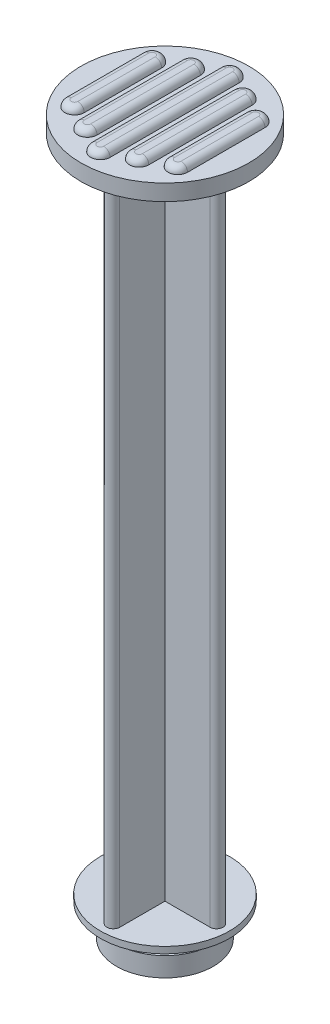
from build123d import *

# Parameters (mm, degrees)
SKETCH4_W           = 2
SKETCH4_H           = 2
BOSS_EXTRUDE5_DEPTH = 102
SKETCH5_R           = 13
BOSS_EXTRUDE6_DEPTH = 2.5
BOSS_EXTRUDE7_DEPTH = 1
FILLET1_R           = 1


with BuildPart() as part:
    # Sketch3 → Revolve1 (revolve)
    with BuildSketch(Plane.XY, mode=Mode.PRIVATE) as revolve1_sk:
        Polygon((0, 0), (7.5, 0), (7.5, 3), (6, 3), (6, 5), (10, 5), (10, 6), (0, 6), align=None)
    revolve(revolve1_sk.sketch.rotate(Axis((0, 6, 0), (0, -1, 0)), 180), axis=Axis((0, 6, 0), (0, -1, 0)))

    # Sketch4 → Boss-Extrude5 (add)
    with BuildSketch(Plane(origin=(0, 6, 0), x_dir=(1, 0, 0), z_dir=(0, 1, 0))):
        with BuildLine():
            ThreePointArc((1, 8), (0, 9), (-1, 8))
            Line((-1, 8), (-1, 1))
            Line((-1, 1), (1, 1))
            Line((1, 1), (1, 8))
        make_face()
        with BuildLine():
            Line((-1, -1), (-1, 1))
            Line((-1, 1), (-8, 1))
            ThreePointArc((-8, 1), (-9, 0), (-8, -1))
            Line((-8, -1), (-1, -1))
        make_face()
        with BuildLine():
            Line((1, -1), (-1, -1))
            Line((-1, -1), (-1, -8))
            ThreePointArc((-1, -8), (0, -9), (1, -8))
            Line((1, -8), (1, -1))
        make_face()
        with BuildLine():
            Line((8, 1), (1, 1))
            Line((1, 1), (1, -1))
            Line((1, -1), (8, -1))
            ThreePointArc((8, -1), (9, 0), (8, 1))
        make_face()
        Rectangle(SKETCH4_W, SKETCH4_H)
    extrude(amount=BOSS_EXTRUDE5_DEPTH)

    # Sketch5 → Boss-Extrude6 (add)
    with BuildSketch(Plane(origin=(0, 108, 0), x_dir=(1, 0, 0), z_dir=(0, 1, 0))):
        with Locations(Location((0, 0, 0), (0, 0, 270))):
            Circle(SKETCH5_R)
    extrude(amount=BOSS_EXTRUDE6_DEPTH)

    # Sketch8 → Boss-Extrude7 (add)
    with BuildSketch(Plane(origin=(0, 110.5, 0), x_dir=(1, 0, 0), z_dir=(0, 1, 0))):
        with BuildLine():
            Line((-1.5, 10), (-1.5, -10))
            ThreePointArc((-1.5, -10), (0, -11.5), (1.5, -10))
            Line((1.5, -10), (1.5, 10))
            ThreePointArc((1.5, 10), (0, 11.5), (-1.5, 10))
        make_face()
        with BuildLine():
            Line((-5.5, 8), (-5.5, -8))
            ThreePointArc((-5.5, -8), (-4, -9.5), (-2.5, -8))
            Line((-2.5, -8), (-2.5, 8))
            ThreePointArc((-2.5, 8), (-4, 9.5), (-5.5, 8))
        make_face()
        with BuildLine():
            Line((-9.5, 6), (-9.5, -6))
            ThreePointArc((-9.5, -6), (-8, -7.5), (-6.5, -6))
            Line((-6.5, -6), (-6.5, 6))
            ThreePointArc((-6.5, 6), (-8, 7.5), (-9.5, 6))
        make_face()
        with BuildLine():
            Line((6.5, 6), (6.5, -6))
            ThreePointArc((6.5, -6), (8, -7.5), (9.5, -6))
            Line((9.5, -6), (9.5, 6))
            ThreePointArc((9.5, 6), (8, 7.5), (6.5, 6))
        make_face()
        with BuildLine():
            Line((5.5, 8), (5.5, -8))
            ThreePointArc((5.5, -8), (4, -9.5), (2.5, -8))
            Line((2.5, -8), (2.5, 8))
            ThreePointArc((2.5, 8), (4, 9.5), (5.5, 8))
        make_face()
    extrude(amount=BOSS_EXTRUDE7_DEPTH)

    # Fillet1
    fillet1_edges = [part.edges().sort_by_distance(p)[0] for p in [
        (9.5, 111.5, 0),
        (8, 111.5, 7.5),
        (6.5, 111.5, 0),
        (8, 111.5, -7.5),
        (5.5, 111.5, 0),
        (4, 111.5, 9.5),
        (2.5, 111.5, 0),
        (4, 111.5, -9.5),
        (1.5, 111.5, 0),
        (0, 111.5, 11.5),
        (-1.5, 111.5, 0),
        (0, 111.5, -11.5),
        (-2.5, 111.5, 0),
        (-4, 111.5, 9.5),
        (-5.5, 111.5, 0),
        (-4, 111.5, -9.5),
        (-6.5, 111.5, 0),
        (-8, 111.5, 7.5),
        (-9.5, 111.5, 0),
        (-8, 111.5, -7.5),
    ]]
    fillet(fillet1_edges, radius=FILLET1_R - 0.0001)  # a hair under: the kernel refuses the full size


solid = part.part
